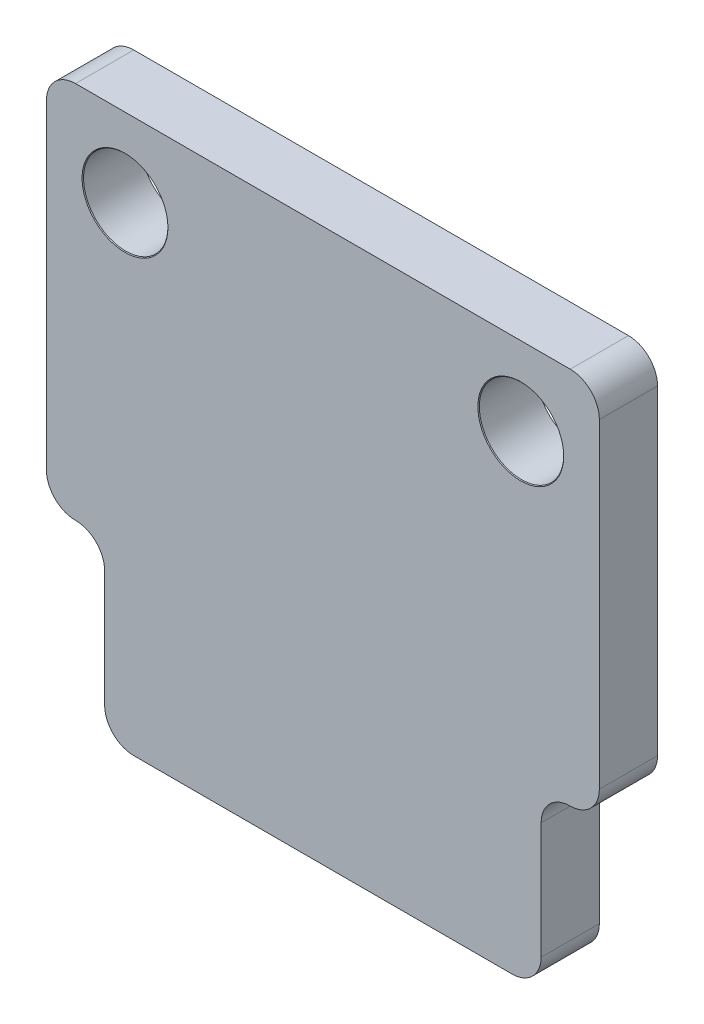
from build123d import *

# Parameters (mm, degrees)
BOSS_EXTRU_1_DEPTH           = 2
CONG_3_R                     = 1
D_GAGEMENT_M2_51_D           = 2.9
D_GAGEMENT_M2_51_CSINK_D     = 2.95
D_GAGEMENT_M2_51_CSINK_ANGLE = 90


with BuildPart() as part:
    # Esquisse1 → Boss.-Extru.1 (new body)
    with BuildSketch(Plane.XY):
        Polygon((-9.5, 19), (9.5, 19), (9.5, 6), (7.5, 6), (7.5, 0), (-7.5, 0), (-7.5, 6), (-9.5, 6), align=None)
    extrude(amount=BOSS_EXTRU_1_DEPTH)

    # Congé3
    cong_3_edges = [part.edges().sort_by_distance(p)[0] for p in [
        (9.5, 19, 1),
        (9.5, 6, 1),
        (7.5, 6, 1),
        (7.5, 0, 1),
        (-7.5, 0, 1),
        (-7.5, 6, 1),
        (-9.5, 6, 1),
        (-9.5, 19, 1),
    ]]
    fillet(cong_3_edges, radius=CONG_3_R - 0.0001)  # a hair under: the kernel refuses the full size

    # Dégagement M2.51 (through all)
    with Locations(Plane(origin=(-6.8, 16.3, 2), x_dir=(1, 0, 0), z_dir=(0, 0, 1))):
        with Locations((0, 0), (13.6, 0)):
            CounterSinkHole(D_GAGEMENT_M2_51_D / 2, D_GAGEMENT_M2_51_CSINK_D / 2, counter_sink_angle=D_GAGEMENT_M2_51_CSINK_ANGLE)


solid = part.part
